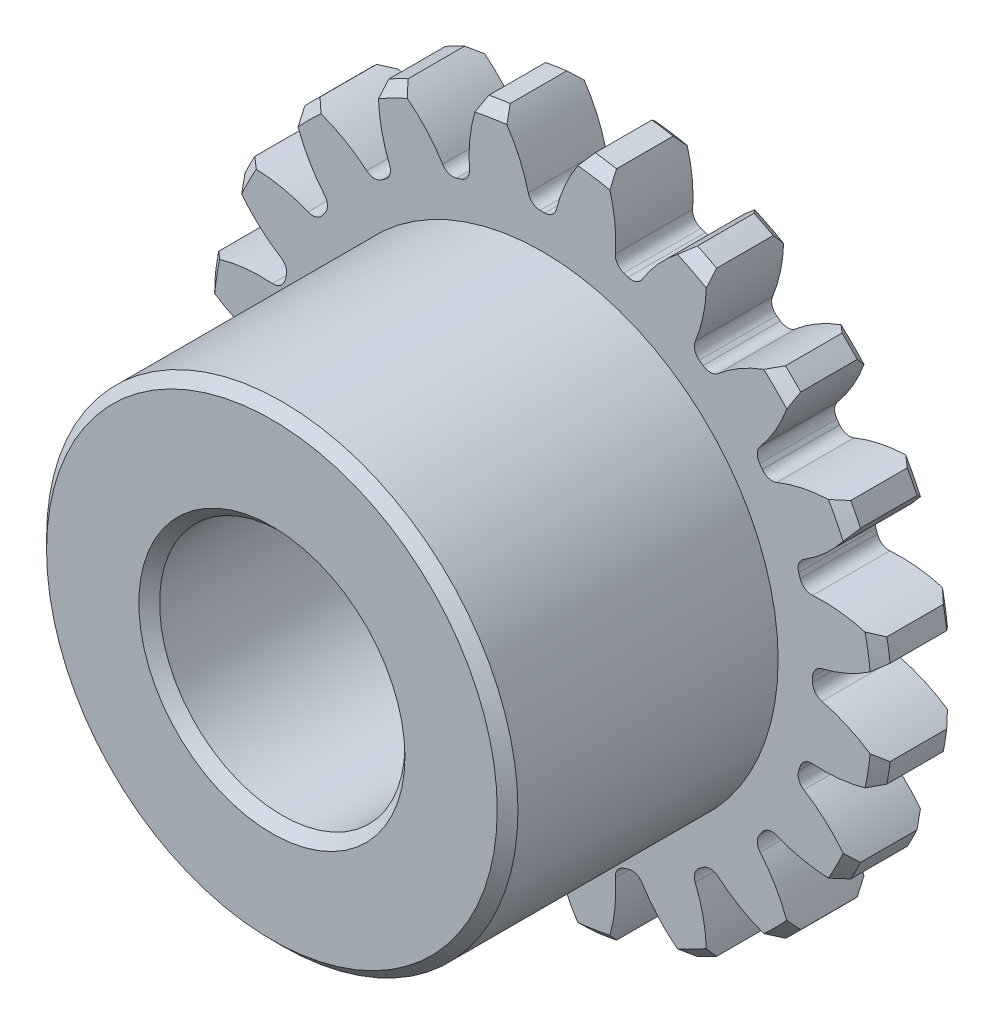
from build123d import *

# Parameters (mm, degrees)
BOSS_EXTRUDE1_DEPTH      = 7
BOSS_EXTRUDE1_DEPTH_BACK = 2
SKETCH3_R                = 8.8
SKETCH5_W                = 7
SKETCH5_H                = 2.7
SKETCH5_W_2              = 9
SKETCH5_H_2              = 3.175
SKETCH6_W                = 12.2
SKETCH6_H                = 0.8128
CUT_EXTRUDE2_DEPTH       = 1
CHAMFER1_SIZE            = 0.268404029
CUT_EXTRUDE1_DEPTH       = 15.278655399
FILLET1_R                = 0.314159265
CIRPATTERN1_COUNT        = 20
FILLET1_OF_CIRPATTERN1_R = 0.314159265
FILLET2_R                = 0.4064
FILLET3_R                = 0.4064


with BuildPart() as part:
    # Sketch3 → Boss-Extrude1 (new, two sides: drawn at the far end of the back side and taken through both)
    with BuildSketch(Plane.XY.offset(-BOSS_EXTRUDE1_DEPTH_BACK)):
        Circle(SKETCH3_R)
    extrude(amount=BOSS_EXTRUDE1_DEPTH + BOSS_EXTRUDE1_DEPTH_BACK)

    # Sketch5 → Cut-Revolve1 (revolve, cut)
    with BuildSketch(Plane(origin=(0, 0, 0), x_dir=(0, 0, -1), z_dir=(1, 0, 0)), mode=Mode.PRIVATE) as cut_revolve1_sk:
        with Locations((-3.5, 7.45)):
            Rectangle(SKETCH5_W, SKETCH5_H)
        with Locations((-2.5, 1.5875)):
            Rectangle(SKETCH5_W_2, SKETCH5_H_2)
    revolve(cut_revolve1_sk.sketch.rotate(Axis((0, 0, 7), (0, 0, -1)), 90), axis=Axis((0, 0, 7), (0, 0, -1)), mode=Mode.SUBTRACT)

    # Sketch6 → Cut-Extrude2 (cut)
    with BuildSketch(Plane.XY.offset(-2)):
        Rectangle(SKETCH6_W, SKETCH6_H)
    extrude(amount=CUT_EXTRUDE2_DEPTH, mode=Mode.SUBTRACT)

    # Chamfer1
    chamfer1_edges = [part.edges().sort_by_distance(p)[0] for p in [
        (-3.175, 0, 7),
        (0, 3.175, -2),
        (-8.8, 0, 0),
        (-6.1, 0, 7),
        (0, -3.175, -2),
        (-8.8, 0, -2),
    ]]
    chamfer(chamfer1_edges, length=CHAMFER1_SIZE)

    # Sketch4 → Cut-Extrude1 (cut, symmetric)
    with BuildSketch(Plane.XY):
        with BuildLine():
            Line((6.992946729, 0.314159265), (6.992946729, -0.314159265))
            ThreePointArc((6.992946729, -0.314159265), (7.91069249, -0.600039629), (8.730796223, -1.101452363))
            ThreePointArc((8.730796223, -1.101452363), (8.8, 0), (8.730796223, 1.101452363))
            ThreePointArc((8.730796223, 1.101452363), (7.91069249, 0.600039629), (6.992946729, 0.314159265))
        make_face()
    cut_extrude1 = extrude(amount=CUT_EXTRUDE1_DEPTH, both=True, mode=Mode.SUBTRACT)

    # Fillet1
    fillet1_edges = [part.edges().sort_by_distance(p)[0] for p in [
        (6.992946729, 0.314159265, -1),
        (6.992946729, -0.314159265, -1),
    ]]
    fillet(fillet1_edges, radius=FILLET1_R)

    # CirPattern1: Cut-Extrude1 ×20 about axis
    cirpattern1_axis = Axis((0, 0, 0), (0, 0, 1))
    for i in range(1, CIRPATTERN1_COUNT):
        add(cut_extrude1.rotate(cirpattern1_axis, i * 360 / CIRPATTERN1_COUNT), mode=Mode.SUBTRACT)

    # Fillet1 of CirPattern1
    fillet1_of_cirpattern1_edges = [part.edges().sort_by_distance(p)[0] for p in [
        (6.553607003, 2.459722597, -1),
        (6.747768107, 1.862156164, -1),
        (5.472754562, 4.364511142, -1),
        (5.842070928, 3.856190773, -1),
        (3.856190773, 5.842070928, -1),
        (4.364511142, 5.472754562, -1),
        (1.862156164, 6.747768107, -1),
        (2.459722597, 6.553607003, -1),
        (-0.314159265, 6.992946729, -1),
        (0.314159265, 6.992946729, -1),
        (-2.459722597, 6.553607003, -1),
        (-1.862156164, 6.747768107, -1),
        (-4.364511142, 5.472754562, -1),
        (-3.856190773, 5.842070928, -1),
        (-5.842070928, 3.856190773, -1),
        (-5.472754562, 4.364511142, -1),
        (-6.747768107, 1.862156164, -1),
        (-6.553607003, 2.459722597, -1),
        (-6.992946729, -0.314159265, -1),
        (-6.992946729, 0.314159265, -1),
        (-6.553607003, -2.459722597, -1),
        (-6.747768107, -1.862156164, -1),
        (-5.472754562, -4.364511142, -1),
        (-5.842070928, -3.856190773, -1),
        (-3.856190773, -5.842070928, -1),
        (-4.364511142, -5.472754562, -1),
        (-1.862156164, -6.747768107, -1),
        (-2.459722597, -6.553607003, -1),
        (0.314159265, -6.992946729, -1),
        (-0.314159265, -6.992946729, -1),
        (2.459722597, -6.553607003, -1),
        (1.862156164, -6.747768107, -1),
        (4.364511142, -5.472754562, -1),
        (3.856190773, -5.842070928, -1),
        (5.842070928, -3.856190773, -1),
        (5.472754562, -4.364511142, -1),
        (6.747768107, -1.862156164, -1),
        (6.553607003, -2.459722597, -1),
    ]]
    fillet(fillet1_of_cirpattern1_edges, radius=FILLET1_OF_CIRPATTERN1_R)

    # Fillet2
    fillet2_edges = [part.edges().sort_by_distance(p)[0] for p in [
        (6.1, 0.4064, -1.5),
        (6.1, -0.4064, -1.5),
    ]]
    fillet(fillet2_edges, radius=FILLET2_R - 0.0001)  # a hair under: the kernel refuses the full size

    # Fillet3
    fillet3_edges = [part.edges().sort_by_distance(p)[0] for p in [
        (-6.1, -0.4064, -1.5),
        (-6.1, 0.4064, -1.5),
    ]]
    fillet(fillet3_edges, radius=FILLET3_R - 0.0001)  # a hair under: the kernel refuses the full size


solid = part.part
